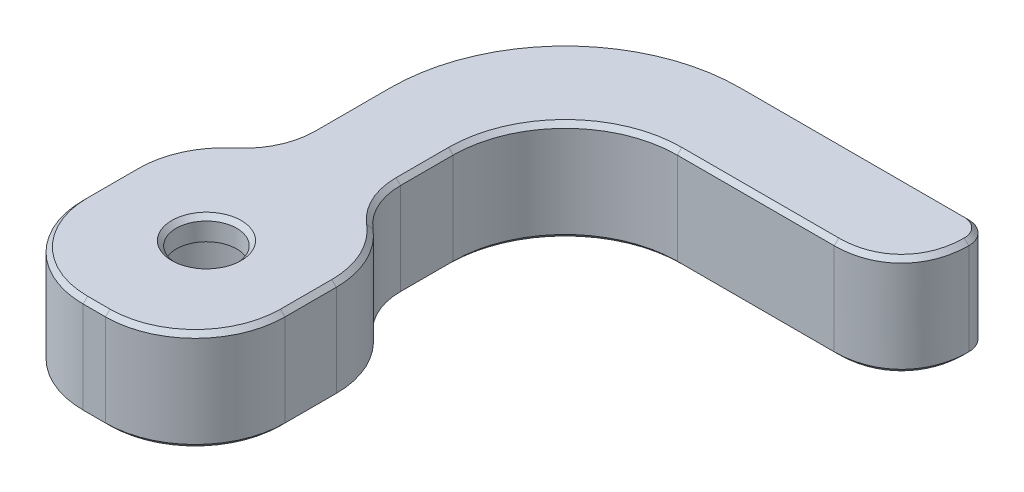
from build123d import *

# Parameters (mm, degrees)
SKETCH_1_R      = 2.4999999999999996
EXTRUDE_1_DEPTH = 4.5
EXTRUDE_START   = -1
SKETCH_3_R      = 2.4999999999999996
SKETCH_3_R_2    = 1.3499999999999994
EXTRUDE_3_DEPTH = 1
EXTRUDE_4_DEPTH = 15
FILLET_1_SIZE   = 3
FILLET_3_R      = 5
FILLET_4_R      = 8
FILLET_5_R      = 4
FILLET_6_R      = 3
FILLET_7_R      = 1
CHAMFER_3_SIZE  = 0.2
FILLET_8_R      = 2


# Some blends are built 0.0001 mm under size
with BuildPart() as part:
    # 草图1 → 凸台-拉伸1 (new body)
    with BuildSketch(Plane(origin=(0, 0, 0), x_dir=(1, 0, 0), z_dir=(0, 1, 0))):
        Polygon((6.500000000000001, 10), (9, 10), (9, 0), (0, 0), (0, 10), (2.499999999999998, 10), (2.500000000000002, 23), (6.500000000000003, 23), align=None)
        with Locations(Location((4.5, 5.000000000000001, 0), (0, 0, 270))):
            Circle(SKETCH_1_R, mode=Mode.SUBTRACT)
    extrude(amount=EXTRUDE_1_DEPTH)

    # 草图3 → 凸台-拉伸3 (add)
    with BuildSketch(Plane(origin=(0, 4.5, 0), x_dir=(1, 0, 0), z_dir=(0, 1, 0)).offset(EXTRUDE_START)):
        with Locations(Location((4.5, 5.000000000000001, 0), (0, 0, 270))):
            Circle(SKETCH_3_R)
        with Locations(Location((4.5, 5.000000000000001, 0), (0, 0, 270))):
            Circle(SKETCH_3_R_2, mode=Mode.SUBTRACT)
    extrude(amount=EXTRUDE_3_DEPTH)

    # 草图4 → 凸台-拉伸4 (add)
    with BuildSketch(Plane(origin=(6.499999999999999, 0, 8.7e-16), x_dir=(-2.9e-16, 0, -1), z_dir=(1, 0, -2.9e-16))):
        Polygon((23, 4.5), (19, 4.499999999999999), (19, 0), (23, 1.2e-16), align=None)
    extrude(amount=EXTRUDE_4_DEPTH)

    # 圆角1
    # a fillet whose section is not a circle: 3 mm, written as the material it takes off along each edge
    with BuildSketch(Plane(origin=(21.499999999999993, 12, -19.000000000000004), x_dir=(-1, 0, 0), z_dir=(0, -1, 0))) as fillet_1_piece_1:
        with BuildLine():
            Bezier((FILLET_1_SIZE, 0), (0, 0), (0, FILLET_1_SIZE), weights=[1, 0.818181818181818, 1])
            Line((0, FILLET_1_SIZE), (0, 0))
            Line((0, 0), (FILLET_1_SIZE, 0))
        make_face()
    extrude(amount=19.5, mode=Mode.SUBTRACT)

    # 圆角3
    fillet_3_edges = [part.edges().sort_by_distance(p)[0] for p in [
        (6.499999999999994, 2.2499999999999996, -19),
    ]]
    fillet(fillet_3_edges, radius=FILLET_3_R)

    # 圆角4
    fillet_4_edges = [part.edges().sort_by_distance(p)[0] for p in [
        (2.500000000000002, 2.25, -23),
    ]]
    fillet(fillet_4_edges, radius=FILLET_4_R)

    # 圆角5
    # the kernel refuses this fillet: 4 mm, written as the material it takes off along each edge
    with BuildSketch(Plane(origin=(9, -10, 0), x_dir=(-1, 0, 0), z_dir=(0, 1, 0))) as fillet_5_piece_1:
        with BuildLine():
            CenterArc((FILLET_5_R, -FILLET_5_R), FILLET_5_R, 90, 90)
            Line((0, -FILLET_5_R), (-FILLET_5_R * 0.02, -FILLET_5_R))
            Line((-FILLET_5_R * 0.02, -FILLET_5_R), (-FILLET_5_R * 0.02, FILLET_5_R * 0.02))
            Line((-FILLET_5_R * 0.02, FILLET_5_R * 0.02), (FILLET_5_R, FILLET_5_R * 0.02))
            Line((FILLET_5_R, FILLET_5_R * 0.02), (FILLET_5_R, 0))
        make_face()
    extrude(amount=24.5, mode=Mode.SUBTRACT)
    with BuildSketch(Plane(origin=(0, -10, 0), x_dir=(0, 0, -1), z_dir=(0, 1, 0))) as fillet_5_piece_2:
        with BuildLine():
            CenterArc((FILLET_5_R, -FILLET_5_R), FILLET_5_R, 90, 90)
            Line((-4.4e-16, -FILLET_5_R), (-FILLET_5_R * 0.02, -FILLET_5_R))
            Line((-FILLET_5_R * 0.02, -FILLET_5_R), (-FILLET_5_R * 0.02, FILLET_5_R * 0.02))
            Line((-FILLET_5_R * 0.02, FILLET_5_R * 0.02), (FILLET_5_R, FILLET_5_R * 0.02))
            Line((FILLET_5_R, FILLET_5_R * 0.02), (FILLET_5_R, 0))
        make_face()
    extrude(amount=24.5, mode=Mode.SUBTRACT)
    with BuildSketch(Plane(origin=(9, -9.27024810886958, -10), x_dir=(0, 0, 1), z_dir=(0, 1, 0))) as fillet_5_piece_3:
        with BuildLine():
            CenterArc((3.7080992435478315, -4), FILLET_5_R, 90, 67.97568716295783)
            Line((0, -2.499999999999999), (-0.07416198487095649, -2.469999999999999))
            ThreePointArc((-0.07416198487095649, -2.469999999999999), (-0.08000000000000007, -1.25), (-0.08000000000000007, 0))
            Line((-0.08000000000000007, 0), (0, 0.08000000000000007))
            Line((0, 0.08000000000000007), (3.7080992435478315, 0.08000000000000007))
            Line((3.7080992435478315, 0.08000000000000007), (3.7080992435478315, 0))
        make_face()
    extrude(amount=23.04049621773916, mode=Mode.SUBTRACT)
    with BuildSketch(Plane(origin=(0, -9.270248108869577, -10), x_dir=(1, 0, 0), z_dir=(0, 1, 0))) as fillet_5_piece_4:
        with BuildLine():
            CenterArc((4, -3.7080992435478306), FILLET_5_R, 112.0243128370422, 67.9756871629578)
            Line((0, -3.7080992435478306), (-0.08, -3.7080992435478306))
            Line((-0.08, -3.7080992435478306), (-0.08, 0))
            Line((-0.08, 0), (0, 0.08000000000000007))
            ThreePointArc((0, 0.08000000000000007), (1.249999999999999, 0.08000000000000007), (2.4699999999999975, 0.07416198487095649))
            Line((2.4699999999999975, 0.07416198487095649), (2.499999999999998, 0))
        make_face()
    extrude(amount=23.040496217739154, mode=Mode.SUBTRACT)

    # 圆角6
    fillet_6_edges = [part.edges().sort_by_distance(p)[0] for p in [
        (2.499999999999998, 2.25, -10),
        (6.500000000000001, 2.25, -10),
    ]]
    fillet(fillet_6_edges, radius=FILLET_6_R)

    # 圆角7
    fillet_7_edges = [part.edges().sort_by_distance(p)[0] for p in [
        (21.499999999999993, 2.25, -23.000000000000004),
    ]]
    fillet(fillet_7_edges, radius=FILLET_7_R - 0.0001)  # a hair under: the kernel refuses the full size

    # 倒角3
    chamfer_3_edges = [part.edges().sort_by_distance(p)[0] for p in [
        (4.5, 4.5, -6.3500000000000005),
        (15, 4.499999999999999, -19.000000000000004),
        (7.964466094067261, 4.5, -17.535533905932738),
        (7.964466094067261, 0, -17.535533905932738),
        (6.500000000000001, 4.5, -12.826901701916901),
        (6.500000000000001, 0, -12.826901701916901),
        (6.781019098475102, 4.5, -10.386072021741027),
        (6.781019098475102, 0, -10.386072021741027),
        (8.625307868699863, 0, -7.982209265909031),
        (8.625307868699863, 4.5, -7.982209265909031),
        (9, 4.5, -5.145950378226),
        (9, 0, -5.145950378226),
        (7.828427124746191, 4.5, -1.1715728752538102),
        (7.828427124746191, 0, -1.1715728752538102),
        (4.5, 0, 0),
        (4.5, 4.5, 0),
        (1.1715728752538102, 4.5, -1.1715728752538093),
        (1.1715728752538102, 0, -1.1715728752538093),
        (0, 0, -5.145950378226),
        (0, 4.5, -5.145950378226),
        (0.37469213130013657, 4.5, -7.982209265909032),
        (0.37469213130013657, 0, -7.982209265909032),
        (2.2189809015248967, 4.5, -10.386072021741029),
        (2.2189809015248967, 0, -10.386072021741029),
        (2.499999999999999, 0, -13.3269017019169),
        (2.499999999999999, 4.5, -13.3269017019169),
        (4.84314575050762, 4.5, -20.65685424949238),
        (4.84314575050762, 0, -20.65685424949238),
        (15.500049999999996, 4.5, -23.000000000000004),
        (15.500049999999996, 8e-17, -23.000000000000004),
        (21.207136070508422, 0, -22.70713607050843),
        (21.207136070508422, 4.5, -22.70713607050843),
        (20.675000000000082, 4.5, -19.82499999999992),
        (20.675000000000082, 0, -19.82499999999992),
        (4.500000000000001, 0, -7.5),
        (15, 0, -19.000000000000004),
    ]]
    chamfer(chamfer_3_edges, length=CHAMFER_3_SIZE)

    # 圆角8
    # the kernel refuses this fillet: 2 mm, written as the material it takes off along each edge
    with BuildSketch(Plane(origin=(4.5, 0.2, -5.000000000000001), x_dir=(-3.6e-16, 0, 1), z_dir=(-1, 0, -3.6e-16))) as fillet_8_piece_1:
        with BuildLine():
            CenterArc((4.499999999999999, 0.6717797887081369), FILLET_8_R, 180, 25.841932763167165)
            Line((2.499999999999999, 0.6717797887081369), (2.459999999999999, 0.6717797887081369))
            Line((2.459999999999999, 0.6717797887081369), (2.459999999999999, 0))
            Line((2.459999999999999, 0), (2.471715728752537, -0.02828427124746191))
            ThreePointArc((2.471715728752537, -0.02828427124746191), (2.5717157287525376, -0.1282842712474619), (2.6640000000000006, -0.21743559577416274))
            Line((2.6640000000000006, -0.21743559577416274), (2.7, -0.2))
        make_face()
    revolve(axis=Axis((4.5, 0.2, -5.000000000000001), (0, 1, 0)), mode=Mode.SUBTRACT)


solid = part.part
